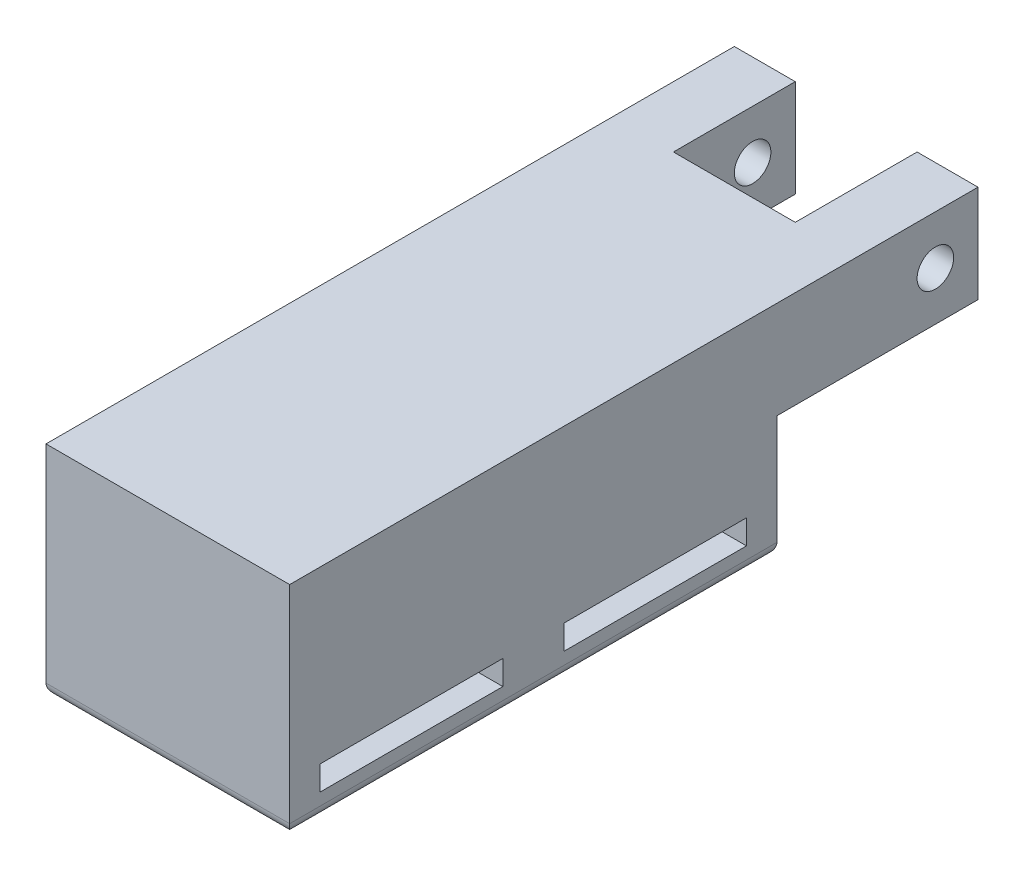
from build123d import *

# Parameters (mm, degrees)
CROQUIS1_R                 = 1.5
SALIENTE_EXTRUIR1_DEPTH    = 10
CORTAR_EXTRUIR1_DEPTH      = 60.539902586
CORTAR_EXTRUIR1_DEPTH_BACK = 60.539902586
CROQUIS2_W                 = 10
CROQUIS2_H                 = 10
CORTAR_EXTRUIR4_DEPTH      = 60.539902586
CORTAR_EXTRUIR4_DEPTH_BACK = 60.539902586
CROQUIS4_W                 = 15
CROQUIS4_H                 = 2
REDONDEO2_R                = 1


with BuildPart() as part:
    # Croquis1 → Saliente-Extruir1 (new, symmetric)
    with BuildSketch(Plane(origin=(0, 0, 0), x_dir=(0, 0, -1), z_dir=(1, 0, 0))):
        Polygon((-1.5, 9), (-58, 9), (-58, -9), (-18, -9), (-18, 1), (-1.5, 1), align=None)
        with Locations((-5, 5)):
            Circle(CROQUIS1_R, mode=Mode.SUBTRACT)
    extrude(amount=SALIENTE_EXTRUIR1_DEPTH, both=True)

    # Croquis2 → Cortar-Extruir1 (cut, two sides: drawn at the far end of the back side and taken through both)
    with BuildSketch(Plane(origin=(0, 0, 0), x_dir=(1, 0, 0), z_dir=(0, 1, 0)).offset(-CORTAR_EXTRUIR1_DEPTH_BACK)):
        with Locations((0, -6.5)):
            Rectangle(CROQUIS2_W, CROQUIS2_H)
    extrude(amount=CORTAR_EXTRUIR1_DEPTH + CORTAR_EXTRUIR1_DEPTH_BACK, mode=Mode.SUBTRACT)

    # Croquis4 → Cortar-Extruir4 (cut, two sides: drawn at the far end of the back side and taken through both)
    with BuildSketch(Plane(origin=(0, 0, 0), x_dir=(0, 0, -1), z_dir=(1, 0, 0)).offset(-CORTAR_EXTRUIR4_DEPTH_BACK)):
        with Locations((-48, -6)):
            Rectangle(CROQUIS4_W, CROQUIS4_H)
        with Locations((-28, -6)):
            Rectangle(CROQUIS4_W, CROQUIS4_H)
    extrude(amount=CORTAR_EXTRUIR4_DEPTH + CORTAR_EXTRUIR4_DEPTH_BACK, mode=Mode.SUBTRACT)

    # Redondeo2
    redondeo2_edges = [part.edges().sort_by_distance(p)[0] for p in [
        (10, -9, 38),
        (-10, -9, 38),
        (0, -9, 58),
        (0, -9, 18),
    ]]
    fillet(redondeo2_edges, radius=REDONDEO2_R)


solid = part.part
